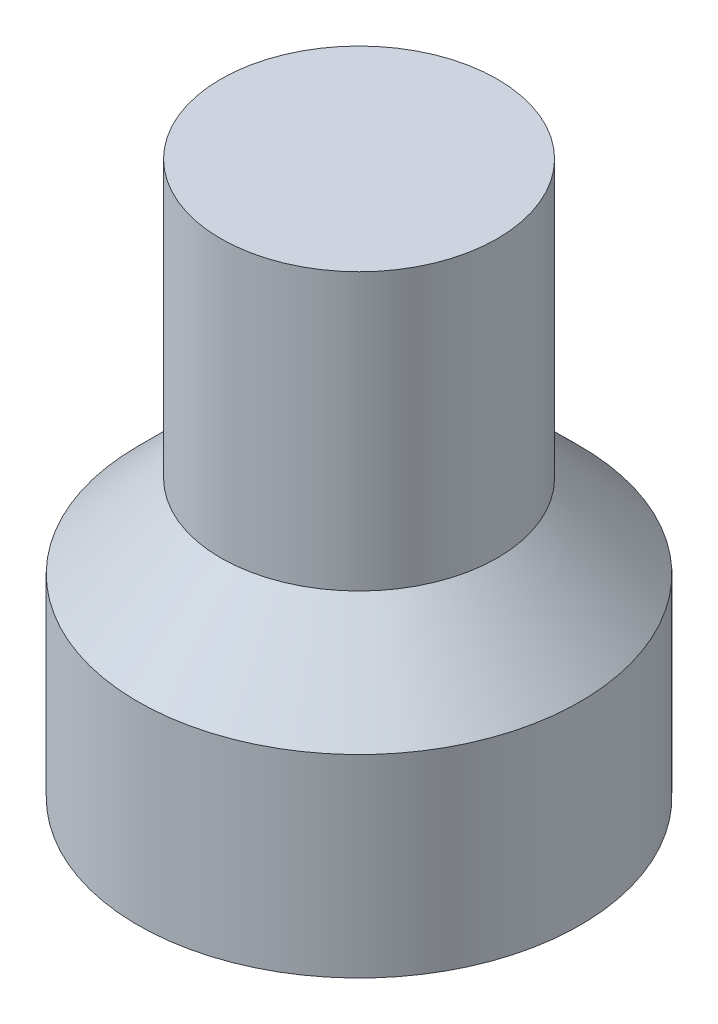
from build123d import *

# Parameters (mm, degrees)
CHAMFER_1_SIZE       = 3
SKETCH_4_R           = 5.1
CUT_EXTRUDE_1_DEPTH  = 5.1
HOLE_WIZARD_M3_D     = 2.5
HOLE_WIZARD_M3_DEPTH = 10
HOLE_WIZARD_M3_TIP   = 0.751075774


with BuildPart() as part:
    # Эскиз1 → Revolve 482 (revolve)
    with BuildSketch(Plane.XY):
        Polygon((0, 10), (-5, 10), (-5, 0), (-8, 0), (-8, -10), (0, -10), align=None)
    revolve(axis=Axis((0, 10, 0), (0, -1, 0)))

    # Фаска1
    chamfer_1_edges = [part.edges().sort_by_distance(p)[0] for p in [
        (8, 0, 0),
    ]]
    chamfer(chamfer_1_edges, length=CHAMFER_1_SIZE - 0.0001)  # a hair under: the kernel refuses the full size

    # Эскиз4 → Вырез-Вытянуть1 (cut)
    with BuildSketch(Plane.XZ.offset(10)):
        Circle(SKETCH_4_R)
    extrude(amount=-CUT_EXTRUDE_1_DEPTH, mode=Mode.SUBTRACT)

    # Крепление магнита M3
    with Locations(Plane(origin=(0, -4.9, 0), x_dir=(-1, 0, 0), z_dir=(0, -1, 0))):
        with Locations((0, 0)):
            Hole(HOLE_WIZARD_M3_D / 2, depth=HOLE_WIZARD_M3_DEPTH)
            with Locations((0, 0, -(HOLE_WIZARD_M3_DEPTH + HOLE_WIZARD_M3_TIP / 2))):  # 118° drill point
                Cone(0, HOLE_WIZARD_M3_D / 2, HOLE_WIZARD_M3_TIP, mode=Mode.SUBTRACT)


solid = part.part
